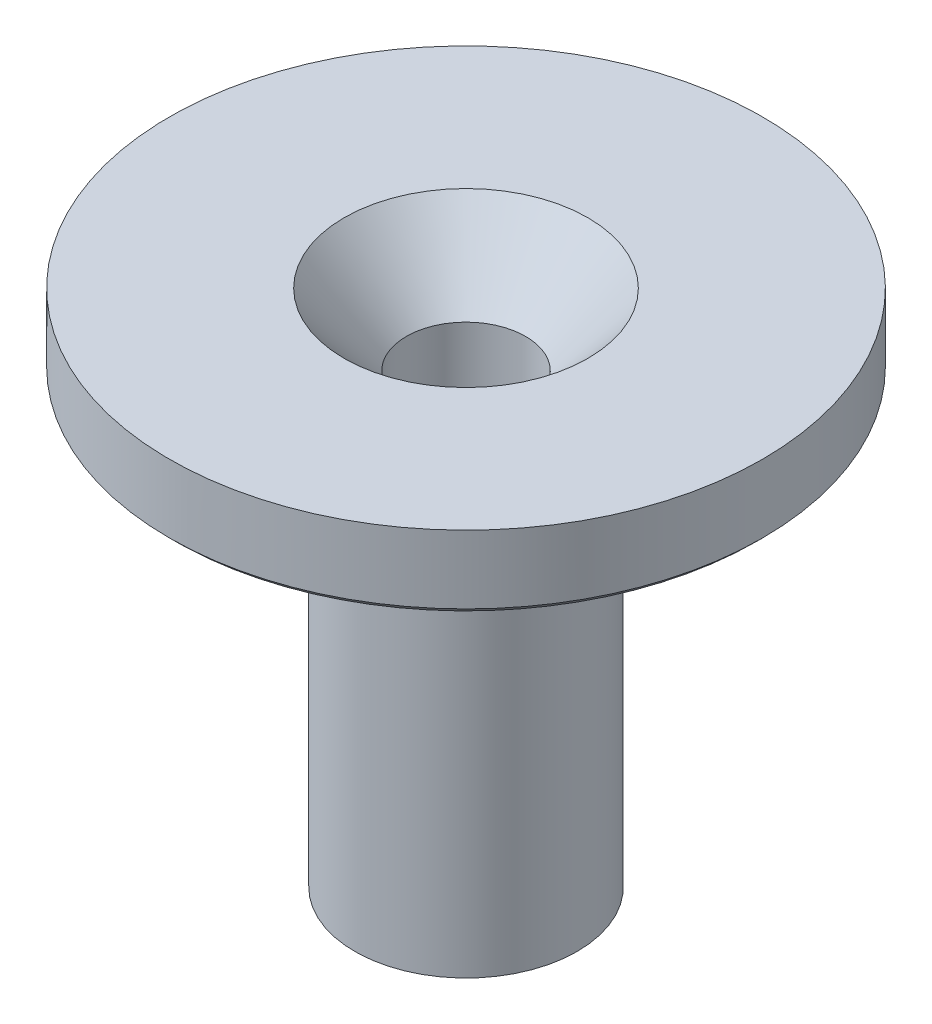
from build123d import *

# Parameters (mm, degrees)
CSK_FOR_10_FLAT_HEAD_SOCKET_CAP_SCREW1_D           = 5.1054
CSK_FOR_10_FLAT_HEAD_SOCKET_CAP_SCREW1_CSINK_D     = 10.4394
CSK_FOR_10_FLAT_HEAD_SOCKET_CAP_SCREW1_CSINK_ANGLE = 82
CHAMFER1_SIZE                                      = 0.254


with BuildPart() as part:
    # Sketch2 → Revolve1 (revolve)
    with BuildSketch(Plane.XY):
        Polygon((0, 10.140493615), (-12.7, 10.140493615), (-12.7, 6.965493615), (-4.7625, 6.965493615), (-4.7625, -12.084506385), (0, -12.084506385), align=None)
    revolve(axis=Axis((0, -12.084506385, 0), (0, 1, 0)))

    # CSK for #10 Flat Head Socket Cap Screw1 (through all)
    with Locations(Plane(origin=(0, 10.140493615, 0), x_dir=(1, 0, 0), z_dir=(0, 1, 0))):
        with Locations((0, 0)):
            CounterSinkHole(CSK_FOR_10_FLAT_HEAD_SOCKET_CAP_SCREW1_D / 2, CSK_FOR_10_FLAT_HEAD_SOCKET_CAP_SCREW1_CSINK_D / 2, counter_sink_angle=CSK_FOR_10_FLAT_HEAD_SOCKET_CAP_SCREW1_CSINK_ANGLE)

    # Chamfer1
    chamfer1_edges = [part.edges().sort_by_distance(p)[0] for p in [
        (12.7, 6.965493615, 0),
    ]]
    chamfer(chamfer1_edges, length=CHAMFER1_SIZE)


solid = part.part
